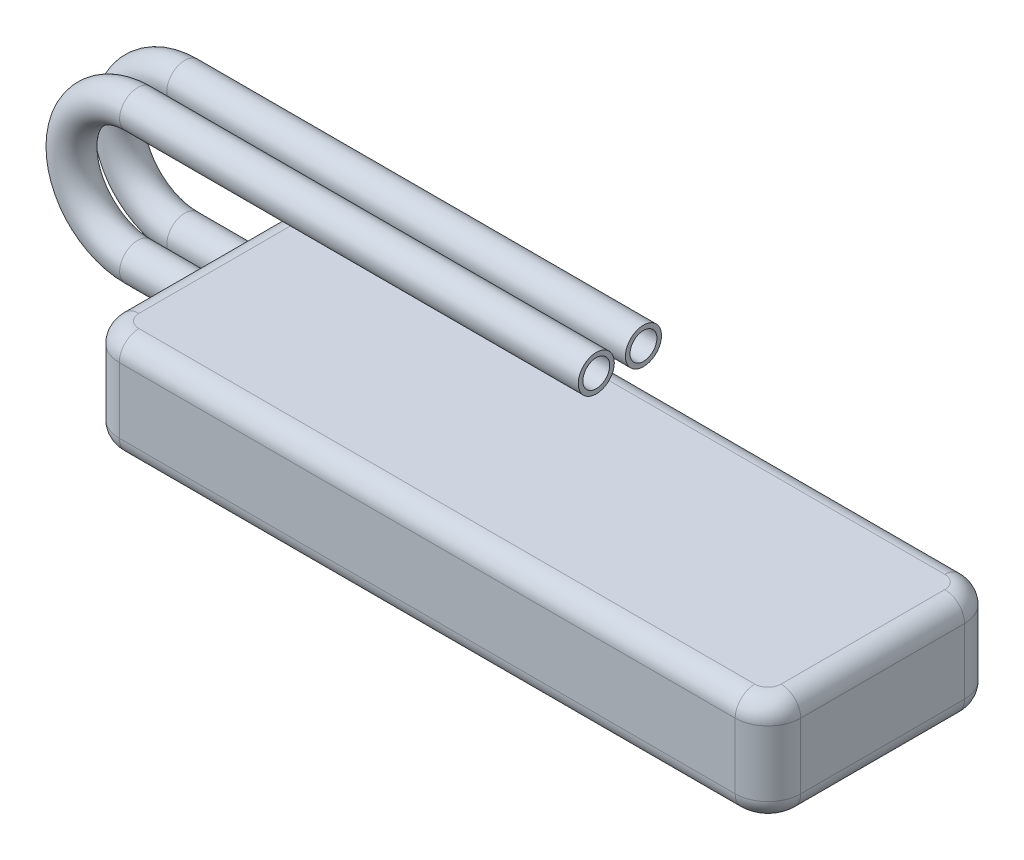
from build123d import *

# Parameters (mm, degrees)
SKETCH_1_W      = 104
SKETCH_1_H      = 16
EXTRUDE_1_DEPTH = 35
SKETCH_2_R      = 2.75
SKETCH_2_R_2    = 2.05
FILLET_1_R      = 3
FILLET_2_R      = 5


with BuildPart() as part:
    # 草图1 → 凸台-拉伸1 (new body)
    with BuildSketch(Plane.XY):
        with Locations((52, 8)):
            Rectangle(SKETCH_1_W, SKETCH_1_H)
    extrude(amount=-EXTRUDE_1_DEPTH)

    # 扫描1: sweep along a path in 草图3
    with BuildLine(Plane.XY) as sweep_1_path:
        Line((0, 11.6), (-10, 11.6))
        ThreePointArc((-10, 11.6), (-18.5, 20.1), (-10, 28.6))
        Line((-10, 28.6), (60, 28.6))
    # 草图2 → 扫描1 (sweep)
    # profile 1 of 2: a face of its own
    with BuildSketch(Plane(origin=(0, 0, 0), x_dir=(0, 0, -1), z_dir=(1, 0, 0))):
        with Locations((25, 10)):
            Circle(SKETCH_2_R)
        with Locations((25, 10)):
            Circle(SKETCH_2_R_2, mode=Mode.SUBTRACT)
    # profile 2 of 2: a face of its own
    with BuildSketch(Plane(origin=(0, 0, 0), x_dir=(0, 0, -1), z_dir=(1, 0, 0))):
        with Locations((17.8, 10)):
            Circle(SKETCH_2_R)
        with Locations((17.8, 10)):
            Circle(SKETCH_2_R_2, mode=Mode.SUBTRACT)
    sweep(path=sweep_1_path.line)

    # 圆角1
    fillet_1_edges = [part.edges().sort_by_distance(p)[0] for p in [
        (52, 16, -35),
        (52, 16, 0),
        (52, 0, 0),
        (0, 16, -17.5),
        (104, 16, -17.5),
        (104, 0, -17.5),
        (0, 0, -17.5),
        (52, 0, -35),
    ]]
    fillet(fillet_1_edges, radius=FILLET_1_R)

    # 圆角2
    # the kernel refuses this fillet: 5 mm, written as the material it takes off along each edge
    with BuildSketch(Plane(origin=(5, 0, -30), x_dir=(-1, 0, 0), z_dir=(0, 0, 1))) as fillet_2_piece_1:
        with BuildLine():
            CenterArc((2, -3), 3, 0, 90)
            Line((5, -3), (5, 0))
            Line((5, 0), (2, 0))
        make_face()
    revolve(axis=Axis((5, 0, -30), (0, -1, 0)), revolution_arc=90, mode=Mode.SUBTRACT)
    with BuildSketch(Plane(origin=(5, 0, -5), x_dir=(0, 0, 1), z_dir=(1, 0, 0))) as fillet_2_piece_2:
        with BuildLine():
            CenterArc((2, -3), 3, 0, 90)
            Line((5, -3), (5, 0))
            Line((5, 0), (2, 0))
        make_face()
    revolve(axis=Axis((5, 0, -5), (0, -1, 0)), revolution_arc=90, mode=Mode.SUBTRACT)
    with BuildSketch(Plane(origin=(99, 0, -30), x_dir=(0, 0, -1), z_dir=(-1, 0, 0))) as fillet_2_piece_3:
        with BuildLine():
            CenterArc((2, -3), 3, 0, 90)
            Line((5, -3), (5, 0))
            Line((5, 0), (2, 0))
        make_face()
    revolve(axis=Axis((99, 0, -30), (0, -1, 0)), revolution_arc=90, mode=Mode.SUBTRACT)
    with BuildSketch(Plane(origin=(99, 0, -5), x_dir=(1, 0, 0), z_dir=(0, 0, -1))) as fillet_2_piece_4:
        with BuildLine():
            CenterArc((2, -3), 3, 0, 90)
            Line((5, -3), (5, 0))
            Line((5, 0), (2, 0))
        make_face()
    revolve(axis=Axis((99, 0, -5), (0, -1, 0)), revolution_arc=90, mode=Mode.SUBTRACT)
    with BuildSketch(Plane(origin=(99, 16, -30), x_dir=(1, 0, 0), z_dir=(0, 0, 1))) as fillet_2_piece_5:
        with BuildLine():
            CenterArc((2, -3), 3, 0, 90)
            Line((5, -3), (5, 0))
            Line((5, 0), (2, 0))
        make_face()
    revolve(axis=Axis((99, 16, -30), (0, 1, 0)), revolution_arc=90, mode=Mode.SUBTRACT)
    with BuildSketch(Plane(origin=(99, 16, -5), x_dir=(0, 0, 1), z_dir=(-1, 0, 0))) as fillet_2_piece_6:
        with BuildLine():
            CenterArc((2, -3), 3, 0, 90)
            Line((5, -3), (5, 0))
            Line((5, 0), (2, 0))
        make_face()
    revolve(axis=Axis((99, 16, -5), (0, 1, 0)), revolution_arc=90, mode=Mode.SUBTRACT)
    with BuildSketch(Plane(origin=(5, 16, -30), x_dir=(0, 0, -1), z_dir=(1, 0, 0))) as fillet_2_piece_7:
        with BuildLine():
            CenterArc((2, -3), 3, 0, 90)
            Line((5, -3), (5, 0))
            Line((5, 0), (2, 0))
        make_face()
    revolve(axis=Axis((5, 16, -30), (0, 1, 0)), revolution_arc=90, mode=Mode.SUBTRACT)
    with BuildSketch(Plane(origin=(5, 16, -5), x_dir=(-1, 0, 0), z_dir=(0, 0, -1))) as fillet_2_piece_8:
        with BuildLine():
            CenterArc((2, -3), 3, 0, 90)
            Line((5, -3), (5, 0))
            Line((5, 0), (2, 0))
        make_face()
    revolve(axis=Axis((5, 16, -5), (0, 1, 0)), revolution_arc=90, mode=Mode.SUBTRACT)
    with BuildSketch(Plane(origin=(104, 0, 0), x_dir=(-1, 0, 0), z_dir=(0, 1, 0)), Plane(origin=(104, 0, -35), x_dir=(0, 0, 1), z_dir=(0, 1, 0)), Plane(origin=(0, 16, -35), x_dir=(0, 0, 1), z_dir=(0, -1, 0)), Plane(origin=(0, 16, 0), x_dir=(1, 0, 0), z_dir=(0, -1, 0))) as fillet_2_piece_9:
        with BuildLine():
            CenterArc((FILLET_2_R, -FILLET_2_R), FILLET_2_R, 90, 90)
            Line((0, -FILLET_2_R), (0, 0))
            Line((0, 0), (FILLET_2_R, 0))
        make_face()
    extrude(amount=16, mode=Mode.SUBTRACT)


solid = part.part
